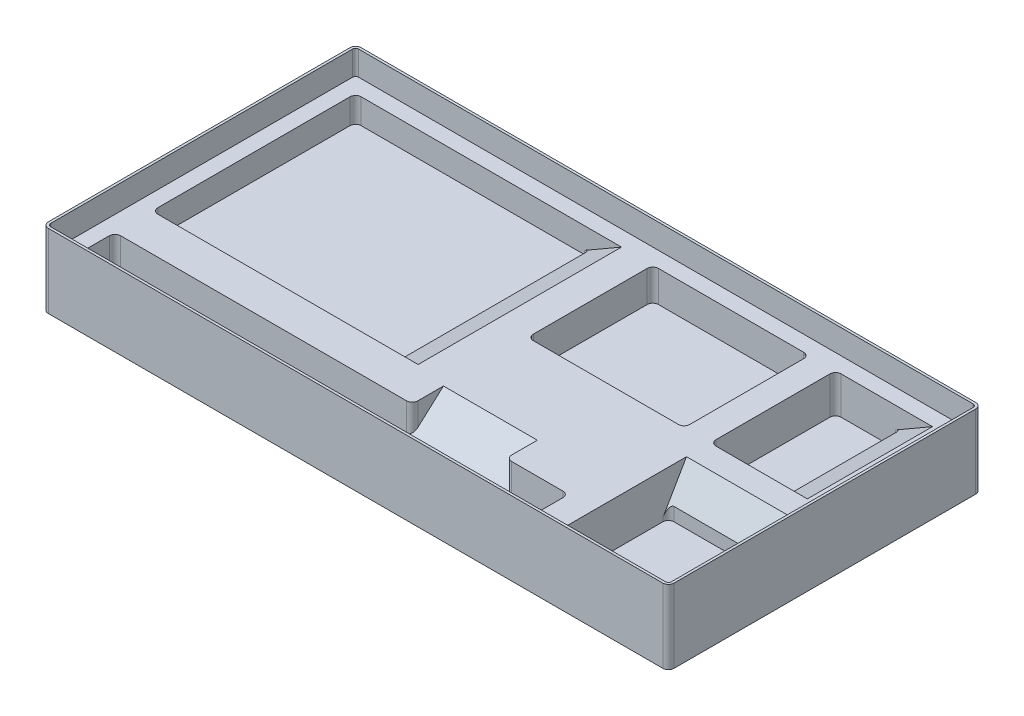
from build123d import *
from OCP.BRepFilletAPI import BRepFilletAPI_MakeChamfer

# Parameters (mm, degrees)
SKETCH1_W           = 200
SKETCH1_H           = 100
BOSS_EXTRUDE1_DEPTH = 0.8
SKETCH2_W           = 200
SKETCH2_H           = 100
SKETCH2_W_2         = 198.4
SKETCH2_H_2         = 98.4
BOSS_EXTRUDE2_DEPTH = 15
SKETCH3_W           = 145
SKETCH3_H           = 11.5
BLENDER_DEPTH       = 12
SKETCH3_3_W         = 75
SKETCH3_3_H         = 65
CHARCOALS_DEPTH     = 8
SKETCH3_4_W         = 50
SKETCH3_4_H         = 40
RUBBER_DEPTH        = 10
SKETCH3_5_W         = 21
SKETCH3_5_H         = 40
ERASER_DEPTH        = 12
SKETCH3_6_W         = 35
SKETCH3_6_H         = 35
SHARPENER_DEPTH     = 14.25
CHAMFER1_SIZE       = 10
CHAMFER1_SIZE2      = 5.773502692
SKETCH3_7_W         = 30
SKETCH3_7_H         = 10
CUT_EXTRUDE6_DEPTH  = 9
CHAMFER2_SIZE       = 9.004040443
CHAMFER2_SIZE_2     = 10
SKETCH4_W           = 200
SKETCH4_H           = 100
SKETCH4_W_2         = 198.4
SKETCH4_H_2         = 98.4
BOSS_EXTRUDE3_DEPTH = 7.8
FILLET1_R           = 1
FILLET2_R           = 1.8
FILLET3_R           = 1.8


with BuildPart() as part:
    # Sketch1 → Boss-Extrude1 (new body)
    with BuildSketch(Plane(origin=(0, 0, 0), x_dir=(1, 0, 0), z_dir=(0, 1, 0))):
        Rectangle(SKETCH1_W, SKETCH1_H)
    extrude(amount=-BOSS_EXTRUDE1_DEPTH)

    # Sketch2 → Boss-Extrude2 (add)
    # profile 1 of 2: a face of its own
    with BuildSketch(Plane(origin=(0, 0, 0), x_dir=(1, 0, 0), z_dir=(0, 1, 0))):
        Rectangle(SKETCH2_W, SKETCH2_H)
        Rectangle(SKETCH2_W_2, SKETCH2_H_2, mode=Mode.SUBTRACT)
    # profile 2 of 2: a face of its own
    with BuildSketch(Plane(origin=(0, 0, 0), x_dir=(1, 0, 0), z_dir=(0, 1, 0))):
        Rectangle(SKETCH2_W_2, SKETCH2_H_2)
    extrude(amount=BOSS_EXTRUDE2_DEPTH)

    # Sketch3 → Blender (cut)
    with BuildSketch(Plane(origin=(0, 15, 0), x_dir=(1, 0, 0), z_dir=(0, 1, 0))):
        with Locations((-21.7, -38.45)):
            Rectangle(SKETCH3_W, SKETCH3_H)
    extrude(amount=-BLENDER_DEPTH, mode=Mode.SUBTRACT)

    # Sketch3<3> → Charcoals (cut)
    with BuildSketch(Plane(origin=(0, 15, 0), x_dir=(1, 0, 0), z_dir=(0, 1, 0))):
        with Locations((-56.7, 11.7)):
            Rectangle(SKETCH3_3_W, SKETCH3_3_H)
    extrude(amount=-CHARCOALS_DEPTH, mode=Mode.SUBTRACT)

    # Sketch3<4> → Rubber (cut)
    with BuildSketch(Plane(origin=(0, 15, 0), x_dir=(1, 0, 0), z_dir=(0, 1, 0))):
        with Locations((25.8, 24.2)):
            Rectangle(SKETCH3_4_W, SKETCH3_4_H)
    extrude(amount=-RUBBER_DEPTH, mode=Mode.SUBTRACT)

    # Sketch3<5> → Eraser (cut)
    with BuildSketch(Plane(origin=(0, 15, 0), x_dir=(1, 0, 0), z_dir=(0, 1, 0))):
        with Locations((69.7, 24.2)):
            Rectangle(SKETCH3_5_W, SKETCH3_5_H)
    extrude(amount=-ERASER_DEPTH, mode=Mode.SUBTRACT)

    # Sketch3<6> → Sharpener (cut)
    with BuildSketch(Plane(origin=(0, 15, 0), x_dir=(1, 0, 0), z_dir=(0, 1, 0))):
        with Locations((76.7, -26.7)):
            Rectangle(SKETCH3_6_W, SKETCH3_6_H)
    extrude(amount=-SHARPENER_DEPTH, mode=Mode.SUBTRACT)

    # Chamfer1: one chamfer whose edges measure the first distance from different faces: ONE call of the kernel's chamfer builder (chamfer() names one face for all edges)
    chamfer1_edges_1 = [part.edges().sort_by_distance(p)[0] for p in [
        (-19.2, 15, -11.7),
        (80.2, 15, -24.2),
    ]]
    chamfer1_side_1 = [part.faces().sort_by_distance(p)[0] for p in [
        (11.550891669, 15, 3.081461272),
    ]]
    chamfer1_edges_2 = [part.edges().sort_by_distance(p)[0] for p in [
        (76.7, 15, 9.2),
    ]]
    chamfer1_side_2 = [part.faces().sort_by_distance(p)[0] for p in [
        (76.7, 7.875, 9.2),
    ]]
    chamfer1 = BRepFilletAPI_MakeChamfer(part.part.solid().wrapped)
    for e in chamfer1_edges_1:
        chamfer1.Add(CHAMFER1_SIZE, CHAMFER1_SIZE2, e.wrapped, chamfer1_side_1[0].wrapped)  # the first distance lies on this face
    for e in chamfer1_edges_2:
        chamfer1.Add(CHAMFER1_SIZE, CHAMFER1_SIZE2, e.wrapped, chamfer1_side_2[0].wrapped)  # the first distance lies on this face
    add(Compound.cast(chamfer1.Shape()), mode=Mode.REPLACE)

    # Sketch3<7> → Cut-Extrude6 (cut)
    with BuildSketch(Plane(origin=(0, 15, 0), x_dir=(1, 0, 0), z_dir=(0, 1, 0))):
        with Locations((15.8, -27.7)):
            Rectangle(SKETCH3_7_W, SKETCH3_7_H)
    extrude(amount=-CUT_EXTRUDE6_DEPTH, mode=Mode.SUBTRACT)

    # Chamfer2
    # the kernel refuses this chamfer: 10, 9.004040443 mm, written as the material it adds along each edge
    with BuildSketch(Plane(origin=(56.551839571, 6, 22.7), x_dir=(0, 0.9994864482690294, -0.032044340008195435), z_dir=(-1, 0, 0))) as chamfer2_piece_1_section:
        Polygon((CHAMFER2_SIZE * 0.999486448267, -CHAMFER2_SIZE * 0.0320443400081), (-CHAMFER2_SIZE_2 * 0.0320443400082, -CHAMFER2_SIZE_2 * 0.999486448269), (0, 0), align=None)
    chamfer2_piece_1 = extrude(amount=81.503679141, mode=Mode.PRIVATE)
    chamfer2_piece_1 = split(chamfer2_piece_1, bisect_by=Plane(origin=(15.8, 15, 26.033334004), z_dir=(0, -1, 0)), keep=Keep.TOP, mode=Mode.PRIVATE)
    add(chamfer2_piece_1)

    # Sketch4 → Boss-Extrude3 (add)
    with BuildSketch(Plane(origin=(0, 15, 0), x_dir=(1, 0, 0), z_dir=(0, 1, 0))):
        Rectangle(SKETCH4_W, SKETCH4_H)
        Rectangle(SKETCH4_W_2, SKETCH4_H_2, mode=Mode.SUBTRACT)
    extrude(amount=BOSS_EXTRUDE3_DEPTH)

    # Fillet1
    fillet1_edges = [part.edges().sort_by_distance(p)[0] for p in [
        (-99.2, 18.9, -49.2),
        (-99.2, 18.9, 49.2),
        (99.2, 18.9, 49.2),
        (99.2, 18.9, -49.2),
    ]]
    fillet(fillet1_edges, radius=FILLET1_R)

    # Fillet2
    fillet2_edges = [part.edges().sort_by_distance(p)[0] for p in [
        (-100, 11, -50),
        (100, 11, -50),
        (100, 11, 50),
        (-100, 11, 50),
    ]]
    fillet(fillet2_edges, radius=FILLET2_R)

    # Fillet3
    # the kernel refuses this fillet: 1.8 mm, written as the material it adds along each edge
    with BuildSketch(Plane(origin=(50.8, 15, 44.2), x_dir=(0, 0, -1), z_dir=(0, -1, 0)), Plane(origin=(50.8, 15, 32.7), x_dir=(-1, 0, 0), z_dir=(0, -1, 0)), Plane(origin=(59.2, 15, -4.2), x_dir=(1, 0, 0), z_dir=(0, -1, 0))) as fillet3_piece_1:
        with BuildLine():
            CenterArc((FILLET3_R, -FILLET3_R), FILLET3_R, 90, 90)
            Line((0, -FILLET3_R), (0, 0))
            Line((0, 0), (FILLET3_R, 0))
        make_face()
    extrude(amount=12)
    with BuildSketch(Plane(origin=(-94.2, 15, 44.2), x_dir=(0, 0, -1), z_dir=(0, -1, 0)), Plane(origin=(-94.2, 15, 32.7), x_dir=(1, 0, 0), z_dir=(0, -1, 0)), Plane(origin=(59.2, 15, -44.2), x_dir=(1, 0, 0), z_dir=(0, -1, 0))) as fillet3_piece_2:
        with BuildLine():
            CenterArc((FILLET3_R, FILLET3_R), FILLET3_R, 180, 90)
            Line((0, FILLET3_R), (0, 0))
            Line((0, 0), (FILLET3_R, 0))
        make_face()
    extrude(amount=12)
    with BuildSketch(Plane(origin=(-19.2, 13.726497308, 20.8), x_dir=(-1, 0, 0), z_dir=(0, -1, 0))) as fillet3_piece_3_section:
        with BuildLine():
            CenterArc((FILLET3_R, FILLET3_R), FILLET3_R, 180, 90)
            Line((0, FILLET3_R), (0, 0))
            Line((0, 0), (FILLET3_R, 0))
        make_face()
    fillet3_piece_3 = extrude(amount=11.226497308, mode=Mode.PRIVATE)
    fillet3_piece_3 = split(fillet3_piece_3, bisect_by=Plane(origin=(-20.005000388, 8.761730117, 20.378537809), z_dir=(0.5000000000000009, -0.8660254037844382, 0)), keep=Keep.TOP, mode=Mode.PRIVATE)
    add(fillet3_piece_3)
    with BuildSketch(Plane(origin=(-94.2, 15, 20.8), x_dir=(1, 0, 0), z_dir=(0, -1, 0)), Plane(origin=(-94.2, 15, -44.2), x_dir=(0, 0, 1), z_dir=(0, -1, 0))) as fillet3_piece_4:
        with BuildLine():
            CenterArc((FILLET3_R, -FILLET3_R), FILLET3_R, 90, 90)
            Line((0, -FILLET3_R), (0, 0))
            Line((0, 0), (FILLET3_R, 0))
        make_face()
    extrude(amount=12.5)
    with BuildSketch(Plane(origin=(-19.2, 13.726497308, -44.2), x_dir=(-1, 0, 0), z_dir=(0, -1, 0))) as fillet3_piece_5_section:
        with BuildLine():
            CenterArc((FILLET3_R, -FILLET3_R), FILLET3_R, 90, 90)
            Line((0, -FILLET3_R), (0, 0))
            Line((0, 0), (FILLET3_R, 0))
        make_face()
    fillet3_piece_5 = extrude(amount=11.226497308, mode=Mode.PRIVATE)
    fillet3_piece_5 = split(fillet3_piece_5, bisect_by=Plane(origin=(-20.005000388, 8.761730117, -43.778537809), z_dir=(0.5000000000000009, -0.8660254037844382, 0)), keep=Keep.TOP, mode=Mode.PRIVATE)
    add(fillet3_piece_5)
    with BuildSketch(Plane(origin=(50.8, 15, -4.2), x_dir=(-1, 0, 0), z_dir=(0, -1, 0)), Plane(origin=(50.8, 15, -44.2), x_dir=(0, 0, 1), z_dir=(0, -1, 0))) as fillet3_piece_6:
        with BuildLine():
            CenterArc((FILLET3_R, FILLET3_R), FILLET3_R, 180, 90)
            Line((0, FILLET3_R), (0, 0))
            Line((0, 0), (FILLET3_R, 0))
        make_face()
    extrude(amount=14.5)
    with BuildSketch(Plane(origin=(0.8, 15, -4.2), x_dir=(1, 0, 0), z_dir=(0, -1, 0)), Plane(origin=(0.8, 15, -44.2), x_dir=(0, 0, 1), z_dir=(0, -1, 0))) as fillet3_piece_7:
        with BuildLine():
            CenterArc((FILLET3_R, -FILLET3_R), FILLET3_R, 90, 90)
            Line((0, -FILLET3_R), (0, 0))
            Line((0, 0), (FILLET3_R, 0))
        make_face()
    extrude(amount=14.5)
    with BuildSketch(Plane(origin=(80.2, 13.726497308, -4.2), x_dir=(-1, 0, 0), z_dir=(0, -1, 0))) as fillet3_piece_8_section:
        with BuildLine():
            CenterArc((FILLET3_R, FILLET3_R), FILLET3_R, 180, 90)
            Line((0, FILLET3_R), (0, 0))
            Line((0, 0), (FILLET3_R, 0))
        make_face()
    fillet3_piece_8 = extrude(amount=10.726497308, mode=Mode.PRIVATE)
    fillet3_piece_8 = split(fillet3_piece_8, bisect_by=Plane(origin=(78.509719514, 8.250613415, -4.608516769), z_dir=(0.5000000000000009, -0.8660254037844382, 0)), keep=Keep.TOP, mode=Mode.PRIVATE)
    add(fillet3_piece_8)
    with BuildSketch(Plane(origin=(80.2, 13.726497308, -44.2), x_dir=(-1, 0, 0), z_dir=(0, -1, 0))) as fillet3_piece_9_section:
        with BuildLine():
            CenterArc((FILLET3_R, -FILLET3_R), FILLET3_R, 90, 90)
            Line((0, -FILLET3_R), (0, 0))
            Line((0, 0), (FILLET3_R, 0))
        make_face()
    fillet3_piece_9 = extrude(amount=10.726497308, mode=Mode.PRIVATE)
    fillet3_piece_9 = split(fillet3_piece_9, bisect_by=Plane(origin=(78.509719514, 8.250613415, -43.791483231), z_dir=(0.5000000000000009, -0.8660254037844382, 0)), keep=Keep.TOP, mode=Mode.PRIVATE)
    add(fillet3_piece_9)
    with BuildSketch(Plane(origin=(94.2, 9.5, 9.2), x_dir=(0, 0, 1), z_dir=(0, -1, 0))) as fillet3_piece_10_section:
        with BuildLine():
            CenterArc((FILLET3_R, FILLET3_R), FILLET3_R, 180, 90)
            Line((0, FILLET3_R), (0, 0))
            Line((0, 0), (FILLET3_R, 0))
        make_face()
    fillet3_piece_10 = extrude(amount=8.75, mode=Mode.PRIVATE)
    fillet3_piece_10 = split(fillet3_piece_10, bisect_by=Plane(origin=(93.765274696, 3.031109619, 10.336739391), z_dir=(0, -0.500000000000001, -0.866025403784438)), keep=Keep.TOP, mode=Mode.PRIVATE)
    add(fillet3_piece_10)
    with BuildSketch(Plane(origin=(94.2, 15, 44.2), x_dir=(-1, 0, 0), z_dir=(0, -1, 0)), Plane(origin=(59.2, 15, 44.2), x_dir=(0, 0, -1), z_dir=(0, -1, 0))) as fillet3_piece_11:
        with BuildLine():
            CenterArc((FILLET3_R, FILLET3_R), FILLET3_R, 180, 90)
            Line((0, FILLET3_R), (0, 0))
            Line((0, 0), (FILLET3_R, 0))
        make_face()
    extrude(amount=14.25)
    with BuildSketch(Plane(origin=(59.2, 9.5, 9.2), x_dir=(0, 0, 1), z_dir=(0, -1, 0))) as fillet3_piece_12_section:
        with BuildLine():
            CenterArc((FILLET3_R, -FILLET3_R), FILLET3_R, 90, 90)
            Line((0, -FILLET3_R), (0, 0))
            Line((0, 0), (FILLET3_R, 0))
        make_face()
    fillet3_piece_12 = extrude(amount=8.75, mode=Mode.PRIVATE)
    fillet3_piece_12 = split(fillet3_piece_12, bisect_by=Plane(origin=(59.634725304, 3.031109619, 10.336739391), z_dir=(0, -0.500000000000001, -0.866025403784438)), keep=Keep.TOP, mode=Mode.PRIVATE)
    add(fillet3_piece_12)
    # the kernel refuses this fillet: 1.8 mm, written as the material it takes off along each edge
    with BuildSketch(Plane(origin=(0.8, 19.5, 32.7), x_dir=(0, 0, -1), z_dir=(0, -1, 0))) as fillet3_2_piece_1_section:
        with BuildLine():
            CenterArc((FILLET3_R, -FILLET3_R), FILLET3_R, 90, 90)
            Line((0, -FILLET3_R), (0, 0))
            Line((0, 0), (FILLET3_R, 0))
        make_face()
    fillet3_2_piece_1 = extrude(amount=18, mode=Mode.PRIVATE)
    fillet3_2_piece_1 = split(fillet3_2_piece_1, bisect_by=Plane(origin=(0.390952326, 8.287487107, 30.159488191), z_dir=(0, 0.7431448254771393, 0.6691306063591413)), keep=Keep.TOP, mode=Mode.PRIVATE)
    add(fillet3_2_piece_1, mode=Mode.SUBTRACT)
    with BuildSketch(Plane(origin=(30.8, 19.5, 32.7), x_dir=(1, 0, 0), z_dir=(0, -1, 0))) as fillet3_2_piece_2_section:
        with BuildLine():
            CenterArc((FILLET3_R, -FILLET3_R), FILLET3_R, 90, 90)
            Line((0, -FILLET3_R), (0, 0))
            Line((0, 0), (FILLET3_R, 0))
        make_face()
    fillet3_2_piece_2 = extrude(amount=18, mode=Mode.PRIVATE)
    fillet3_2_piece_2 = split(fillet3_2_piece_2, bisect_by=Plane(origin=(31.209047674, 8.287487107, 30.159488191), z_dir=(0, 0.7431448254771393, 0.6691306063591413)), keep=Keep.TOP, mode=Mode.PRIVATE)
    add(fillet3_2_piece_2, mode=Mode.SUBTRACT)


solid = part.part
